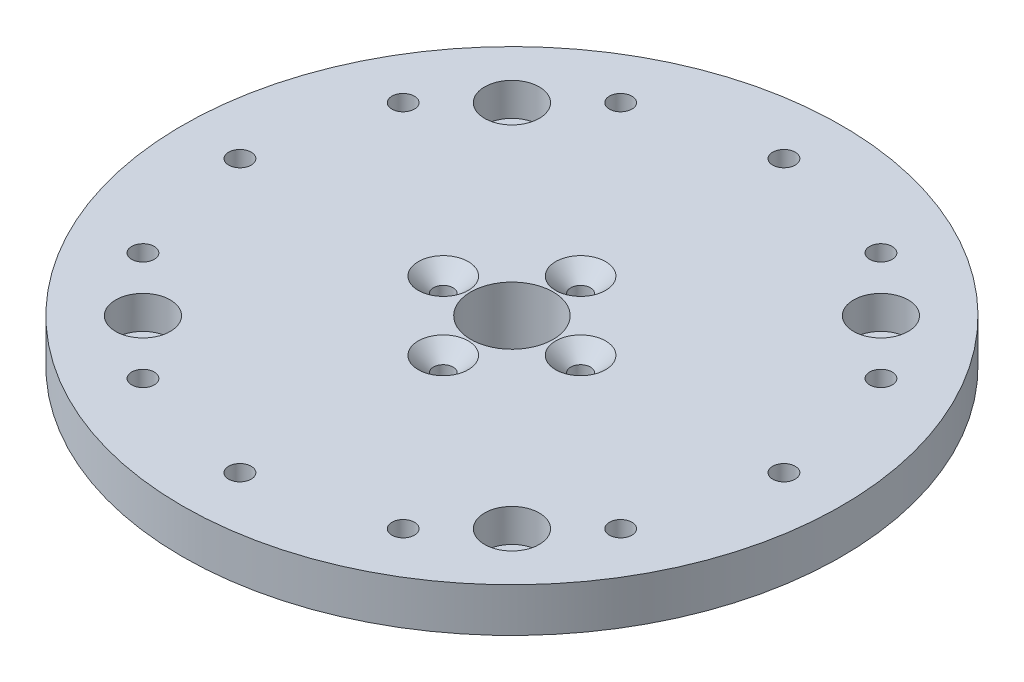
from build123d import *

# Parameters (mm, degrees)
SKETCH1_R                                           = 60
BOSS_EXTRUDE1_DEPTH                                 = 8
SKETCH2_R                                           = 4.975
SKETCH2_R_2                                         = 2.05
CUT_EXTRUDE1_DEPTH                                  = 86.229103011
CIRPATTERN1_COUNT                                   = 4
SKETCH4_R                                           = 34.5
SKETCH4_R_2                                         = 30.5
BOSS_EXTRUDE2_DEPTH                                 = 12.5
SKETCH5_R                                           = 20
BOSS_EXTRUDE3_DEPTH                                 = 1
SKETCH6_R                                           = 17.5
BOSS_EXTRUDE4_DEPTH                                 = 18
SKETCH7_R                                           = 7.5
CUT_EXTRUDE2_DEPTH                                  = 90.044932478
BOSS_EXTRUDE6_START                                 = -2
SKETCH9_R                                           = 4.975
BOSS_EXTRUDE6_DEPTH                                 = 2
SKETCH10_R                                          = 4.975
BOSS_EXTRUDE7_DEPTH                                 = 3
CHAMFER2_START                                      = -3.006253442
CHAMFER2_DEPTH                                      = 0.006253442
CHAMFER2_START_2                                    = -7.5000001
CHAMFER2_2_DEPTH                                    = 4.493746658
CHAMFER2_3_ANGLE                                    = 16.582247
CIRPATTERN2_COUNT                                   = 4
CSK_FOR_M4_COUNTERSUNK_FLAT_HEAD_SCREW1_D           = 3.6
CSK_FOR_M4_COUNTERSUNK_FLAT_HEAD_SCREW1_CSINK_D     = 9.1
CSK_FOR_M4_COUNTERSUNK_FLAT_HEAD_SCREW1_CSINK_ANGLE = 90
BOSS_EXTRUDE8_DEPTH                                 = 12.5


with BuildPart() as part:
    # Sketch1 → Boss-Extrude1 (new body)
    with BuildSketch(Plane(origin=(0, 0, 0), x_dir=(1, 0, 0), z_dir=(0, 1, 0))):
        with Locations(Location((0, 0, 0), (0, 0, 270))):
            Circle(SKETCH1_R)
    extrude(amount=BOSS_EXTRUDE1_DEPTH)

    # Sketch2 → Cut-Extrude1 (cut, through all)
    with BuildSketch(Plane(origin=(0, 8, 0), x_dir=(1, 0, 0), z_dir=(0, 1, 0))):
        with Locations(Location((-33.587572106, -33.587572106, 0), (0, 0, 270))):
            Circle(SKETCH2_R)
        with Locations(Location((-43.487067043, -23.68807717, 0), (0, 0, 270))):
            Circle(SKETCH2_R_2)
        with Locations(Location((-23.68807717, -43.487067043, 0), (0, 0, 270))):
            Circle(SKETCH2_R_2)
        with Locations(Location((0, -49.52, 0), (0, 0, 270))):
            Circle(SKETCH2_R_2)
    cut_extrude1 = extrude(amount=-CUT_EXTRUDE1_DEPTH, mode=Mode.SUBTRACT)

    # CirPattern1: Cut-Extrude1 ×4 about axis
    cirpattern1_axis = Axis((0, 0, 0), (0, 1, 0))
    for i in range(1, CIRPATTERN1_COUNT):
        add(cut_extrude1.rotate(cirpattern1_axis, i * 360 / CIRPATTERN1_COUNT), mode=Mode.SUBTRACT)

    # Sketch4 → Boss-Extrude2 (add)
    with BuildSketch(Plane.XZ):
        with Locations(Location((0, 0, 0), (0, 0, 90))):
            Circle(SKETCH4_R)
        with Locations(Location((0, 0, 0), (0, 0, 270))):
            Circle(SKETCH4_R_2, mode=Mode.SUBTRACT)
    extrude(amount=BOSS_EXTRUDE2_DEPTH)

    # Sketch5 → Boss-Extrude3 (add)
    with BuildSketch(Plane.XZ):
        with Locations(Location((0, 0, 0), (0, 0, 90))):
            Circle(SKETCH5_R)
    extrude(amount=BOSS_EXTRUDE3_DEPTH)

    # Sketch6 → Boss-Extrude4 (add)
    with BuildSketch(Plane.XZ.offset(1)):
        with Locations(Location((0, 0, 0), (0, 0, 270))):
            Circle(SKETCH6_R)
    extrude(amount=BOSS_EXTRUDE4_DEPTH)

    # Sketch7 → Cut-Extrude2 (cut, through all)
    with BuildSketch(Plane.XZ.offset(19)):
        with Locations(Location((0, 0, 0), (0, 0, 270))):
            Circle(SKETCH7_R)
    extrude(amount=-CUT_EXTRUDE2_DEPTH, mode=Mode.SUBTRACT)

    # Sketch9 → Boss-Extrude6 (add)
    with BuildSketch(Plane.XZ.offset(BOSS_EXTRUDE6_START)):
        with Locations(Location((-33.587572106, -33.587572106, 0), (0, 0, 180))):
            Circle(SKETCH9_R)
        with Locations(Location((-33.587572106, 33.587572106, 0), (0, 0, 90))):
            Circle(SKETCH9_R)
        with Locations((33.587572106, 33.587572106)):
            Circle(SKETCH9_R)
        with Locations(Location((33.587572106, -33.587572106, 0), (0, 0, 270))):
            Circle(SKETCH9_R)
    extrude(amount=BOSS_EXTRUDE6_DEPTH)

    # Sketch10 → Boss-Extrude7 (add)
    with BuildSketch(Plane.XZ):
        with BuildLine():
            Line((20.6223527, -27.658065173), (30.06971587, -37.105428343))
            ThreePointArc((30.06971587, -37.105428343), (30.06971587, -30.06971587), (37.105428343, -30.06971587))
            Line((37.105428343, -30.06971587), (27.658065173, -20.6223527))
            ThreePointArc((27.658065173, -20.6223527), (24.395183951, -24.395183951), (20.6223527, -27.658065173))
        make_face()
        with Locations(Location((33.587572106, -33.587572106, 0), (0, 0, 270))):
            Circle(SKETCH10_R)
    boss_extrude7 = extrude(amount=BOSS_EXTRUDE7_DEPTH)

    # Chamfer2: read off the stored shape, not the designer's step
    # Chamfer2 outline → Chamfer2 (add)
    with BuildSketch(Plane(origin=(0, 0, 0), x_dir=(1, 0, 0), z_dir=(0, 1, 0)).offset(CHAMFER2_START)):
        with BuildLine():
            ThreePointArc((37.105428343, 30.06971587), (37.105428343, 37.105428343), (30.06971587, 37.105428343))
            Line((30.06971587, 37.105428343), (20.6223527, 27.658065173))
            ThreePointArc((20.6223527, 27.658065173), (24.395183951, 24.395183951), (27.658065173, 20.6223527))
            Line((27.658065173, 20.6223527), (37.105428343, 30.06971587))
        make_face()
    chamfer2 = extrude(amount=CHAMFER2_DEPTH)

    # Chamfer2 2 outline → Chamfer2 2 (add)
    with BuildSketch(Plane(origin=(0, 0, 0), x_dir=(1, 0, 0), z_dir=(0, 1, 0)).offset(CHAMFER2_START_2)):
        with BuildLine():
            ThreePointArc((37.105428343, 30.06971587), (37.105428343, 37.105428343), (30.06971587, 37.105428343))
            Line((30.06971587, 37.105428343), (20.6223527, 27.658065173))
            ThreePointArc((20.6223527, 27.658065173), (24.395183951, 24.395183951), (27.658065173, 20.6223527))
            Line((27.658065173, 20.6223527), (37.105428343, 30.06971587))
        make_face()
    chamfer2_2 = extrude(amount=CHAMFER2_2_DEPTH)

    # Chamfer2 3 outline → Chamfer2 3 (revolve, cut)
    with BuildSketch(Plane(origin=(0, 0, 0), x_dir=(0.801683048491221, 0, -0.597749353627273), z_dir=(0.597749353627273, 0, 0.801683048491221))):
        Polygon((52.475017897, -3.006245526), (34.5, -7.5), (52.475, -7.5000001), align=None)
    chamfer2_3 = revolve(axis=Axis((0, 0, 0), (0, 1, 0)), revolution_arc=CHAMFER2_3_ANGLE, mode=Mode.SUBTRACT)

    # CirPattern2: Boss-Extrude7, Chamfer2, Chamfer2 2, Chamfer2 3 ×4 about axis
    cirpattern2_axis = Axis((0, 0, 0), (0, 1, 0))
    add([boss_extrude7.rotate(cirpattern2_axis, i * 360 / CIRPATTERN2_COUNT) for i in range(1, CIRPATTERN2_COUNT)])
    add([chamfer2.rotate(cirpattern2_axis, i * 360 / CIRPATTERN2_COUNT) for i in range(1, CIRPATTERN2_COUNT)])
    add([chamfer2_2.rotate(cirpattern2_axis, i * 360 / CIRPATTERN2_COUNT) for i in range(1, CIRPATTERN2_COUNT)])
    add([chamfer2_3.rotate(cirpattern2_axis, i * 360 / CIRPATTERN2_COUNT) for i in range(1, CIRPATTERN2_COUNT)], mode=Mode.SUBTRACT)

    # CSK for M4 Countersunk Flat Head Screw1 (through all)
    with Locations(Plane(origin=(0, 8, -12.5), x_dir=(0, 0, 1), z_dir=(0, 1, 0))):
        with Locations((0, 0), (12.5, 12.5), (25, 0), (12.5, -12.5)):
            CounterSinkHole(CSK_FOR_M4_COUNTERSUNK_FLAT_HEAD_SCREW1_D / 2, CSK_FOR_M4_COUNTERSUNK_FLAT_HEAD_SCREW1_CSINK_D / 2, counter_sink_angle=CSK_FOR_M4_COUNTERSUNK_FLAT_HEAD_SCREW1_CSINK_ANGLE)

    # Sketch13 → Boss-Extrude8 (add)
    with BuildSketch(Plane.XZ):
        with BuildLine():
            Line((-11.79321147, -32.421754475), (-12.732901193, -35.928724264))
            ThreePointArc((-12.732901193, -35.928724264), (-10.611580849, -39.602958878), (-6.937346235, -37.481638534))
            Line((-6.937346235, -37.481638534), (-5.997656512, -33.974668745))
            ThreePointArc((-5.997656512, -33.974668745), (-8.929257056, -33.324441007), (-11.79321147, -32.421754475))
        make_face()
    extrude(amount=BOSS_EXTRUDE8_DEPTH)


solid = part.part
